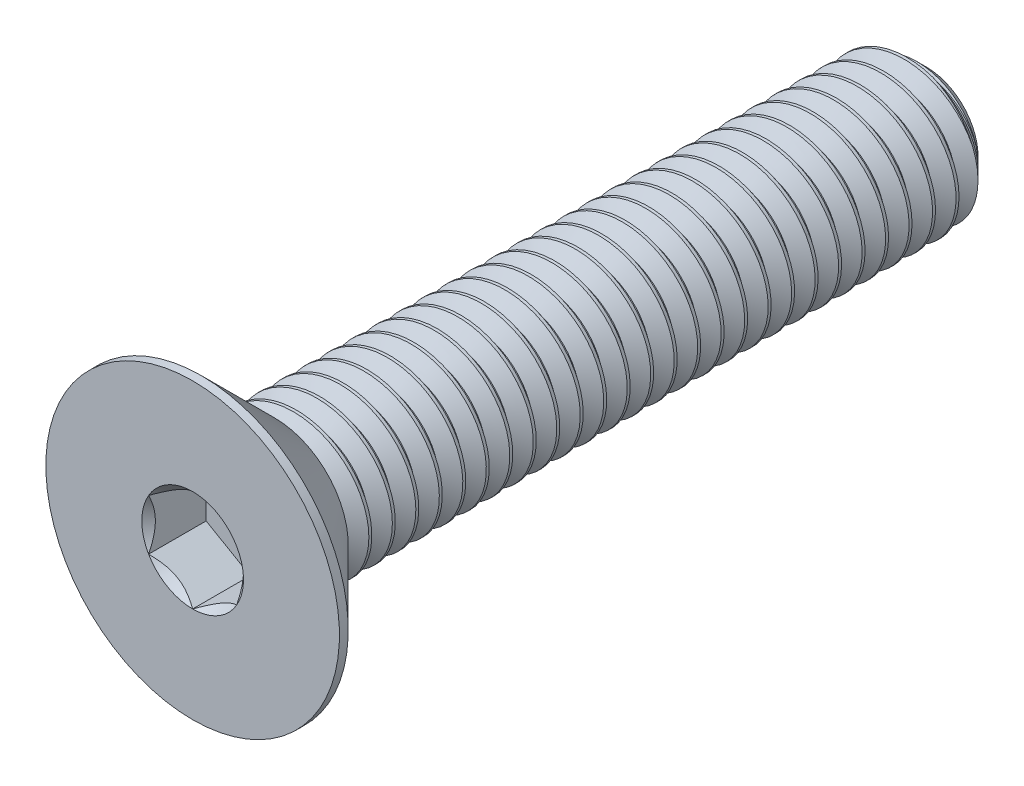
from build123d import *

# Parameters (mm, degrees)
SKETCH3_W          = 25
SKETCH3_H          = 2.5
CHAMFER1_SIZE      = 0.75
CUT_EXTRUDE1_DEPTH = 1.96
CUT_SWEEP1_PITCH   = 0.8
CUT_SWEEP1_TO      = 22.2


with BuildPart() as part:
    # Sketch3 → Revolve1 (revolve)
    with BuildSketch(Plane(origin=(0, 0, 0), x_dir=(0, 0, -1), z_dir=(1, 0, 0))):
        with Locations((0, 1.25)):
            Rectangle(SKETCH3_W, SKETCH3_H)
    revolve(axis=Axis((0, 0, -12.5), (0, 0, 1)))

    # Chamfer1
    chamfer1_edges = [part.edges().sort_by_distance(p)[0] for p in [
        (0, -2.5, -12.5),
    ]]
    chamfer(chamfer1_edges, length=CHAMFER1_SIZE)

    # Sketch6 → Revolve2 (revolve)
    with BuildSketch(Plane(origin=(0, 0, 0), x_dir=(0, 0, -1), z_dir=(1, 0, 0))):
        Polygon((-12.5, 5), (-12.2, 5), (-9.7, 2.5), (-9.7, 0), (-12.5, 0), align=None)
    revolve(axis=Axis((0, 0, -12.5), (0, 0, 1)))

    # Sketch8 → Cut-Extrude1 (cut)
    with BuildSketch(Plane.XY.offset(12.5)):
        Polygon((0, 1.732050808), (-1.5, 0.866025404), (-1.5, -0.866025404), (0, -1.732050808), (1.5, -0.866025404), (1.5, 0.866025404), align=None)
    extrude(amount=-CUT_EXTRUDE1_DEPTH, mode=Mode.SUBTRACT)

    # Cut-Extrude2 cone 1 section (through the dimple's axis) → Cut-Extrude2 (revolve, cut)
    with BuildSketch(Plane(origin=(0, 0, 12.5), x_dir=(0, -1, 0), z_dir=(1, 0, 0))):
        Polygon((0, 0), (1.732050808, 0), (0, 1.732050808), align=None)
    revolve(axis=Axis((0, 0, 12.5), (0, 0, -1)), mode=Mode.SUBTRACT)


with BuildPart() as body_2:
    # Split1: the piece on the far side of the plane
    add(part.part)
    split(bisect_by=Plane.XY.offset(9.7), keep=Keep.BOTTOM)

    # Cut-Sweep1: arcs per turn and ends read off the stored shape
    # Cut-Sweep1: the profile of Sketch10 screwed along a right-hand helix through 28.75 turns, 8 arcs to a turn; built about Z, then put on its axis
    cut_sweep1_z = Axis((0, 0, 0), (0, 0, 1))
    cut_sweep1_corners = [(2.54330127, 0, 0.025), (2.54330127, 0, -0.725), (1.980384758, 0, -0.4), (1.980384758, 0, -0.3)]
    with BuildLine(mode=Mode.PRIVATE) as cut_sweep1_profile:
        Line(cut_sweep1_corners[0], cut_sweep1_corners[1])
        Line(cut_sweep1_corners[1], cut_sweep1_corners[2])
        Line(cut_sweep1_corners[2], cut_sweep1_corners[3])
        Line(cut_sweep1_corners[3], cut_sweep1_corners[0])
    cut_sweep1_cap = Face(cut_sweep1_profile.wire())
    cut_sweep1_turn_angles = [0, 22.5, 45, 67.5, 90, 112.5, 135, 157.5, 180, 202.5, 225, 247.5, 270, 292.5, 315, 337.5, 360]
    cut_sweep1_turn_weights = [1, 0.9238795325112867, 1, 0.9238795325112867, 1, 0.9238795325112867, 1, 0.9238795325112867, 1, 0.9238795325112867, 1, 0.9238795325112867, 1, 0.9238795325112867, 1, 0.9238795325112867, 1]
    cut_sweep1_turn_rails = [Edge.make_bspline([Vector(p[0], p[1], 0).rotate(cut_sweep1_z, cut_sweep1_turn_angles[k]) / cut_sweep1_turn_weights[k] + Vector(0, 0, p[2] + CUT_SWEEP1_PITCH * cut_sweep1_turn_angles[k] / 360) for k in range(17)], [0, 0, 0, 1, 1, 2, 2, 3, 3, 4, 4, 5, 5, 6, 6, 7, 7, 8, 8, 8], 2, cut_sweep1_turn_weights) for p in cut_sweep1_corners]
    cut_sweep1_turn_sides = [Face.make_surface_from_curves(cut_sweep1_turn_rails[p[0]], cut_sweep1_turn_rails[p[1]]) for p in [(0, 1), (1, 2), (2, 3), (3, 0)]]
    cut_sweep1_last_angles = [10080, 10102.5, 10125, 10147.5, 10170, 10192.5, 10215, 10237.5, 10260, 10282.5, 10305, 10327.5, 10350]
    cut_sweep1_last_weights = [1, 0.9238795325112867, 1, 0.9238795325112867, 1, 0.9238795325112867, 1, 0.9238795325112867, 1, 0.9238795325112867, 1, 0.9238795325110013, 1]
    cut_sweep1_last_rails = [Edge.make_bspline([Vector(p[0], p[1], 0).rotate(cut_sweep1_z, cut_sweep1_last_angles[k]) / cut_sweep1_last_weights[k] + Vector(0, 0, p[2] + CUT_SWEEP1_PITCH * cut_sweep1_last_angles[k] / 360) for k in range(13)], [0, 0, 0, 1, 1, 2, 2, 3, 3, 4, 4, 5, 5, 6, 6, 6], 2, cut_sweep1_last_weights) for p in cut_sweep1_corners]
    cut_sweep1_last_sides = [Face.make_surface_from_curves(cut_sweep1_last_rails[p[0]], cut_sweep1_last_rails[p[1]]) for p in [(0, 1), (1, 2), (2, 3), (3, 0)]]
    cut_sweep1 = Plane(origin=(0, 0, -12.5), x_dir=(0, 1, 0), z_dir=(0, 0, 1)) * split(Solid(Shell([*[p.moved(Location((0, 0, CUT_SWEEP1_PITCH * i))) for i in range(28) for p in cut_sweep1_turn_sides], *cut_sweep1_last_sides, cut_sweep1_cap, cut_sweep1_cap.rotate(cut_sweep1_z, 10350).moved(Location((0, 0, CUT_SWEEP1_PITCH * 10350 / 360)))])), bisect_by=Plane.XY.offset(CUT_SWEEP1_TO), keep=Keep.BOTTOM, mode=Mode.PRIVATE)
    add(cut_sweep1, mode=Mode.SUBTRACT)


with BuildPart() as part_1:
    add(part.part)

    # Split1
    split(bisect_by=Plane.XY.offset(9.7), keep=Keep.TOP)


solid = Compound([body_2.part, part_1.part])
